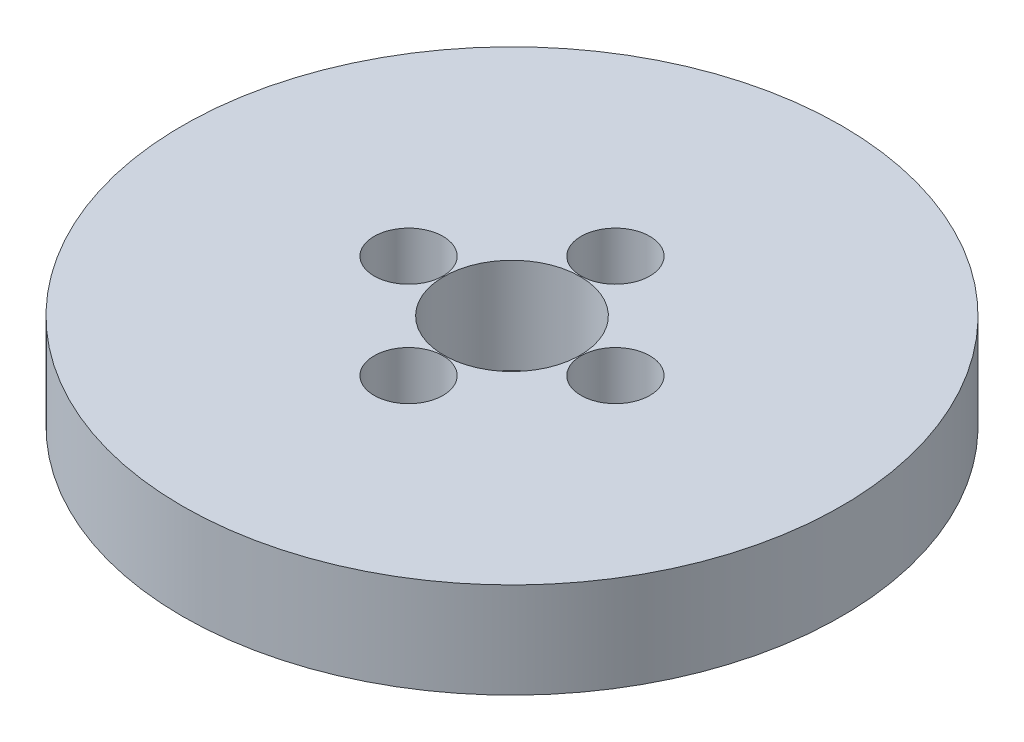
from build123d import *

# Parameters (mm, degrees)
SKETCH1_R           = 72.5
BOSS_EXTRUDE1_DEPTH = 21
SKETCH2_R           = 15
CUT_EXTRUDE1_DEPTH  = 105.658969993
SKETCH3_R           = 7.570186168
CUT_EXTRUDE2_DEPTH  = 15.436386101
CIRPATTERN1_COUNT   = 4


with BuildPart() as part:
    # Sketch1 → Boss-Extrude1 (new body)
    with BuildSketch(Plane(origin=(0, 0, 0), x_dir=(1, 0, 0), z_dir=(0, 1, 0))):
        Circle(SKETCH1_R)
    extrude(amount=BOSS_EXTRUDE1_DEPTH)

    # Sketch2 → Cut-Extrude1 (cut, through all)
    with BuildSketch(Plane(origin=(0, 0, 0), x_dir=(1, 0, 0), z_dir=(0, 1, 0))):
        Circle(SKETCH2_R)
    extrude(amount=CUT_EXTRUDE1_DEPTH, mode=Mode.SUBTRACT)

    # Sketch3 → Cut-Extrude2 (cut)
    with BuildSketch(Plane(origin=(0, 21, 0), x_dir=(1, 0, 0), z_dir=(0, 1, 0))):
        with Locations((-22.754654532, 0)):
            Circle(SKETCH3_R)
    cut_extrude2 = extrude(amount=-CUT_EXTRUDE2_DEPTH, mode=Mode.SUBTRACT)

    # CirPattern1: Cut-Extrude2 ×4 about axis
    cirpattern1_axis = Axis((0, 0, 0), (0, 1, 0))
    for i in range(1, CIRPATTERN1_COUNT):
        add(cut_extrude2.rotate(cirpattern1_axis, i * 360 / CIRPATTERN1_COUNT), mode=Mode.SUBTRACT)


solid = part.part
